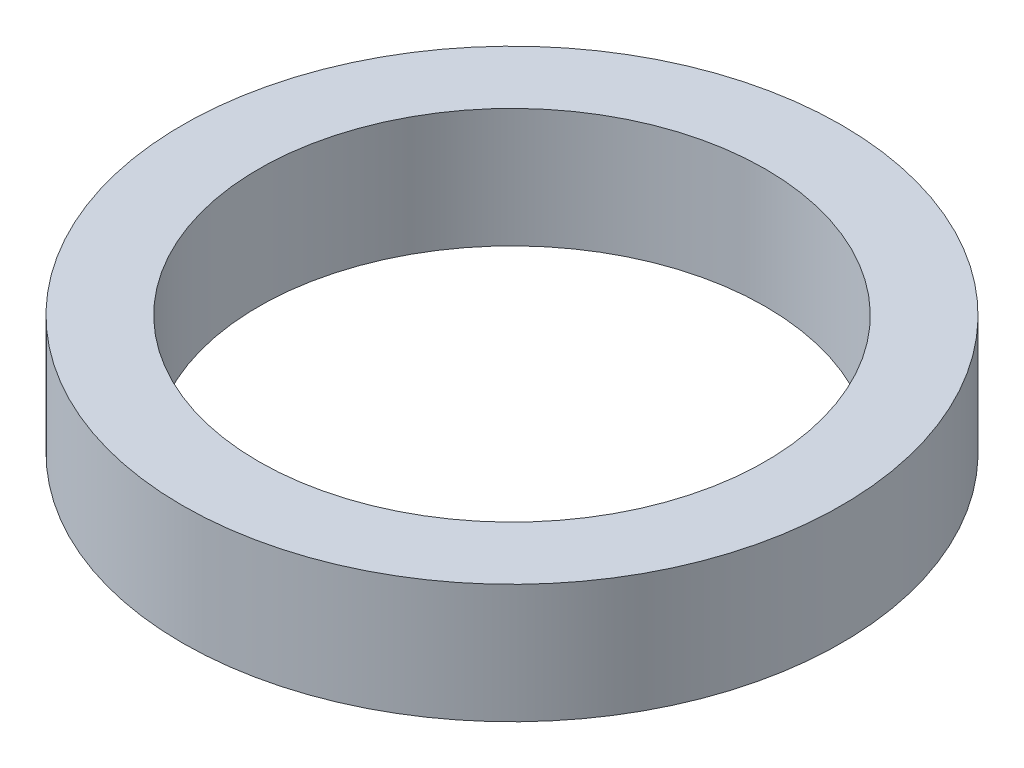
from build123d import *

# Parameters (mm, degrees)
SKETCH1_R           = 4.3942
SKETCH1_R_2         = 3.3782
BOSS_EXTRUDE1_DEPTH = 1.5875


with BuildPart() as part:
    # Sketch1 → Boss-Extrude1 (new body)
    with BuildSketch(Plane(origin=(0, 0, 0), x_dir=(1, 0, 0), z_dir=(0, 1, 0))):
        Circle(SKETCH1_R)
        Circle(SKETCH1_R_2, mode=Mode.SUBTRACT)
    extrude(amount=BOSS_EXTRUDE1_DEPTH)


solid = part.part
